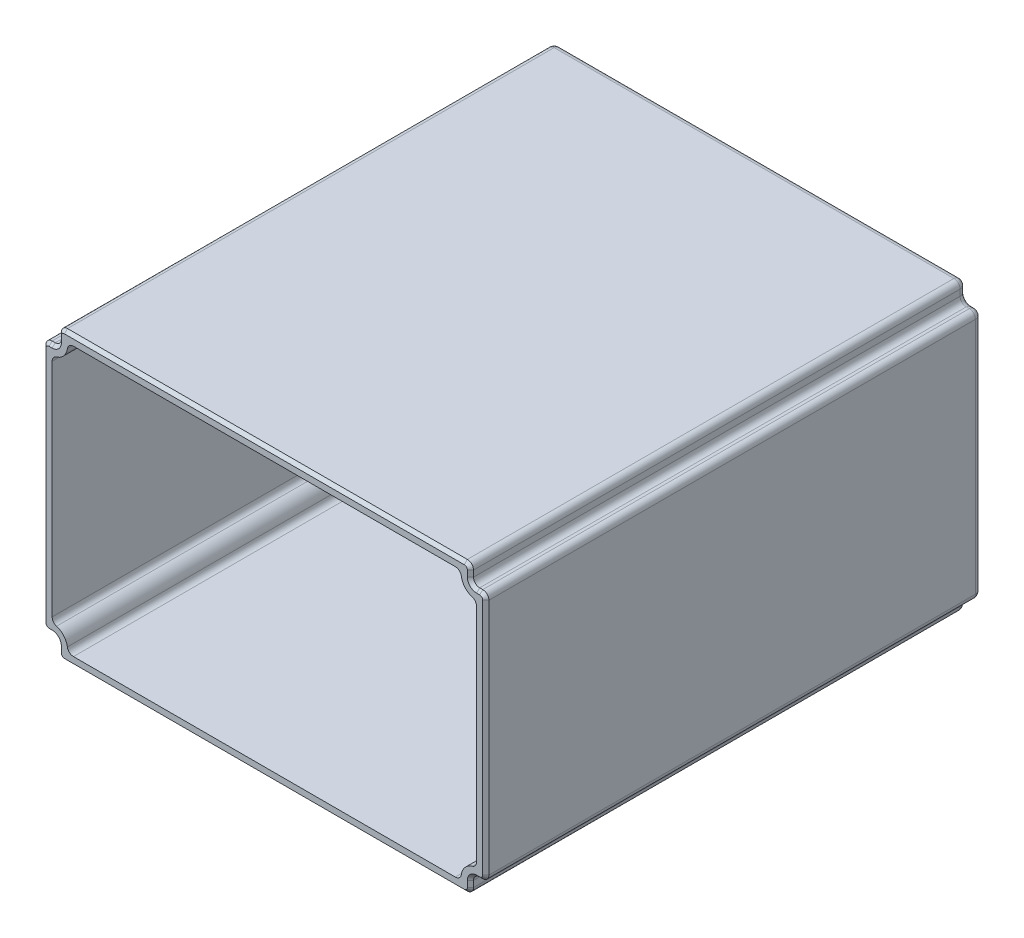
from build123d import *

# Parameters (mm, degrees)
SKETCH_1_W      = 72
SKETCH_1_H      = 40.7
SKETCH_1_W_2    = 67
SKETCH_1_H_2    = 46.7
EXTRUDE_2_DEPTH = 80.6
FILLET_3_R      = 1
SHELL_START     = 1.5
SHELL_2_DEPTH   = 79.1
FILLET_4_R      = 1
FILLET_5_R      = 1
CHAMFER_1_SIZE  = 0.5
FILLET_6_R      = 1


# Read off the part's stored shape, not the designer's step: 抽壳2
with BuildPart() as part:
    # 草图1 → 凸台-拉伸2 (new body)
    with BuildSketch(Plane.XY):
        Rectangle(SKETCH_1_W, SKETCH_1_H)
        Rectangle(SKETCH_1_W_2, SKETCH_1_H_2)
    extrude(amount=EXTRUDE_2_DEPTH)

    # 圆角3
    fillet_3_edges = [part.edges().sort_by_distance(p)[0] for p in [
        (33.5, -20.35, 40.3),
        (-33.5, -20.35, 40.3),
        (-33.5, -23.35, 40.3),
        (33.5, -23.35, 40.3),
        (-36, -20.35, 40.3),
        (36, -20.35, 40.3),
        (36, 20.35, 40.3),
        (-36, 20.35, 40.3),
        (33.5, 20.35, 40.3),
        (-33.5, 20.35, 40.3),
        (-33.5, 23.35, 40.3),
        (33.5, 23.35, 40.3),
    ]]
    fillet(fillet_3_edges, radius=FILLET_3_R)

    # 抽壳2 outline → 抽壳2 (cut)
    with BuildSketch(Plane.XY.offset(SHELL_START)):
        with BuildLine():
            ThreePointArc((34.5, 18.85), (32.732233047, 19.582233047), (32, 21.35))
            Line((32, 21.35), (32, 21.85))
            Line((32, 21.85), (-32, 21.85))
            Line((-32, 21.85), (-32, 21.35))
            ThreePointArc((-32, 21.35), (-32.732233047, 19.582233047), (-34.5, 18.85))
            Line((-34.5, 18.85), (-34.5, -18.85))
            ThreePointArc((-34.5, -18.85), (-32.732233047, -19.582233047), (-32, -21.35))
            Line((-32, -21.35), (-32, -21.85))
            Line((-32, -21.85), (32, -21.85))
            Line((32, -21.85), (32, -21.35))
            ThreePointArc((32, -21.35), (32.732233047, -19.582233047), (34.5, -18.85))
            Line((34.5, -18.85), (34.5, 18.85))
        make_face()
    extrude(amount=SHELL_2_DEPTH, mode=Mode.SUBTRACT)

    # 圆角4
    fillet_4_edges = [part.edges().sort_by_distance(p)[0] for p in [
        (33.5, 21.85, 0),
        (34.75, 20.35, 0),
        (36, 0, 0),
        (34.75, -20.35, 0),
        (33.5, -21.85, 0),
        (0, -23.35, 0),
        (-33.5, -21.85, 0),
        (-34.75, -20.35, 0),
        (-36, 0, 0),
        (-34.75, 20.35, 0),
        (-33.5, 21.85, 0),
        (0, 23.35, 0),
        (35.707106781, -20.057106781, 0),
        (33.207106781, 23.057106781, 0),
        (-33.207106781, 23.057106781, 0),
        (-35.707106781, 20.057106781, 0),
        (-35.707106781, -20.057106781, 0),
        (-33.207106781, -23.057106781, 0),
        (33.207106781, -23.057106781, 0),
        (35.707106781, 20.057106781, 0),
        (33.792893219, 20.642893219, 0),
        (33.792893219, -20.642893219, 0),
        (-33.792893219, -20.642893219, 0),
        (-33.792893219, 20.642893219, 0),
    ]]
    fillet(fillet_4_edges, radius=FILLET_4_R)

    # 圆角5
    fillet_5_edges = [part.edges().sort_by_distance(p)[0] for p in [
        (34.5, 18.85, 41.05),
        (32, 21.85, 41.05),
        (32, 21.35, 41.05),
        (32, -21.85, 41.05),
        (32, -21.35, 41.05),
        (-32, 21.85, 41.05),
        (-32, 21.35, 41.05),
        (-32, -21.35, 41.05),
        (-32, -21.85, 41.05),
        (-34.5, 18.85, 41.05),
        (34.5, -18.85, 41.05),
        (-34.5, -18.85, 41.05),
    ]]
    fillet(fillet_5_edges, radius=FILLET_5_R)

    # 倒角1
    chamfer_1_edges = [part.edges().sort_by_distance(p)[0] for p in [
        (33.5, 21.85, 80.6),
        (34.75, 20.35, 80.6),
        (36, 0, 80.6),
        (0, 23.35, 80.6),
        (-33.5, 21.85, 80.6),
        (-34.75, 20.35, 80.6),
        (-36, 0, 80.6),
        (-34.75, -20.35, 80.6),
        (-33.5, -21.85, 80.6),
        (0, -23.35, 80.6),
        (33.5, -21.85, 80.6),
        (34.75, -20.35, 80.6),
        (35.707106781, -20.057106781, 80.6),
        (33.207106781, 23.057106781, 80.6),
        (-33.207106781, 23.057106781, 80.6),
        (-35.707106781, 20.057106781, 80.6),
        (-35.707106781, -20.057106781, 80.6),
        (-33.207106781, -23.057106781, 80.6),
        (33.207106781, -23.057106781, 80.6),
        (35.707106781, 20.057106781, 80.6),
        (33.792893219, 20.642893219, 80.6),
        (33.792893219, -20.642893219, 80.6),
        (-33.792893219, -20.642893219, 80.6),
        (-33.792893219, 20.642893219, 80.6),
    ]]
    chamfer(chamfer_1_edges, length=CHAMFER_1_SIZE)

    # 圆角6
    fillet_6_edges = [part.edges().sort_by_distance(p)[0] for p in [
        (32.607678605, 19.716255915, 1.5),
        (34.5, 0, 1.5),
        (0, 21.85, 1.5),
        (-32.607678605, 19.716255915, 1.5),
        (-34.5, 0, 1.5),
        (-32.607678605, -19.716255915, 1.5),
        (0, -21.85, 1.5),
        (32.607678605, -19.716255915, 1.5),
        (-34.301783726, -18.593512338, 1.5),
        (34.301783726, -18.593512338, 1.5),
        (31.690552056, -21.605928946, 1.5),
        (-31.690552056, -21.605928946, 1.5),
        (-34.301783726, 18.593512338, 1.5),
        (-31.690552056, 21.605928946, 1.5),
        (31.690552056, 21.605928946, 1.5),
        (34.301783726, 18.593512338, 1.5),
    ]]
    fillet(fillet_6_edges, radius=FILLET_6_R - 0.0001)  # a hair under: the kernel refuses the full size


solid = part.part
